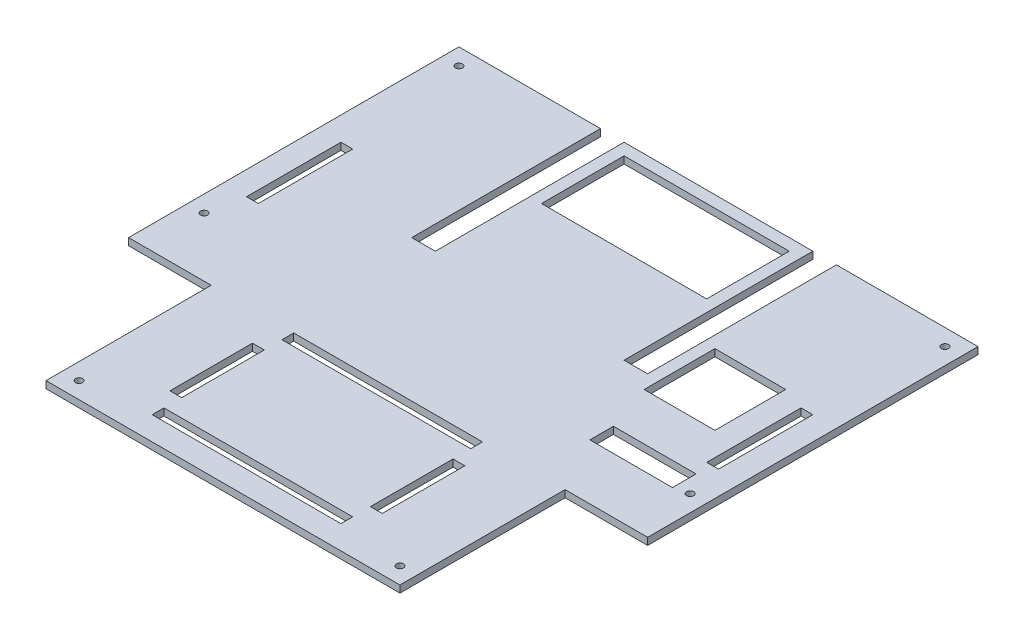
from build123d import *

# Parameters (mm, degrees)
SKETCH4_W           = 220
SKETCH4_H           = 210
BOSS_EXTRUDE1_DEPTH = 3
SKETCH5_W           = 35
SKETCH5_H           = 70
CUT_EXTRUDE1_DEPTH  = 3
SKETCH6_W           = 35
SKETCH6_H           = 70
CUT_EXTRUDE2_DEPTH  = 3
SKETCH22_R          = 1.5
CUT_EXTRUDE15_DEPTH = 3
SKETCH26_R          = 1.5
CUT_EXTRUDE16_DEPTH = 3
SKETCH24_R          = 1.5
CUT_EXTRUDE17_DEPTH = 3
SKETCH25_R          = 1.5
CUT_EXTRUDE18_DEPTH = 3
SKETCH27_R          = 1.5
CUT_EXTRUDE19_DEPTH = 3
SKETCH28_R          = 1.5
CUT_EXTRUDE20_DEPTH = 3
SKETCH56_W          = 10
SKETCH56_H          = 80
SKETCH56_W_2        = 70
SKETCH56_H_2        = 35
CUT_EXTRUDE21_DEPTH = 3
SKETCH57_W          = 80
SKETCH57_H          = 5
SKETCH57_W_2        = 5
SKETCH57_H_2        = 35
SKETCH57_H_3        = 40
SKETCH57_W_3        = 35
SKETCH57_H_4        = 10
SKETCH57_W_4        = 30
SKETCH57_H_5        = 30
CUT_EXTRUDE22_DEPTH = 3


with BuildPart() as part:
    # Sketch4 → Boss-Extrude1 (new body)
    with BuildSketch(Plane(origin=(0, 0, 0), x_dir=(1, 0, 0), z_dir=(0, 1, 0))):
        with Locations((-110, 105)):
            Rectangle(SKETCH4_W, SKETCH4_H)
    extrude(amount=BOSS_EXTRUDE1_DEPTH)

    # Sketch5 → Cut-Extrude1 (cut)
    with BuildSketch(Plane(origin=(0, 3, 0), x_dir=(1, 0, 0), z_dir=(0, 1, 0))):
        with Locations((-202.5, 35)):
            Rectangle(SKETCH5_W, SKETCH5_H)
    extrude(amount=-CUT_EXTRUDE1_DEPTH, mode=Mode.SUBTRACT)

    # Sketch6 → Cut-Extrude2 (cut)
    with BuildSketch(Plane(origin=(0, 3, 0), x_dir=(1, 0, 0), z_dir=(0, 1, 0))):
        with Locations((-17.5, 35)):
            Rectangle(SKETCH6_W, SKETCH6_H)
    extrude(amount=-CUT_EXTRUDE2_DEPTH, mode=Mode.SUBTRACT)

    # Sketch22 → Cut-Extrude15 (cut)
    with BuildSketch(Plane(origin=(0, 3, 0), x_dir=(1, 0, 0), z_dir=(0, 1, 0))):
        with Locations((-178, 7)):
            Circle(SKETCH22_R)
    extrude(amount=-CUT_EXTRUDE15_DEPTH, mode=Mode.SUBTRACT)

    # Sketch26 → Cut-Extrude16 (cut)
    with BuildSketch(Plane(origin=(0, 3, 0), x_dir=(1, 0, 0), z_dir=(0, 1, 0))):
        with Locations((-213, 203)):
            Circle(SKETCH26_R)
    extrude(amount=-CUT_EXTRUDE16_DEPTH, mode=Mode.SUBTRACT)

    # Sketch24 → Cut-Extrude17 (cut)
    with BuildSketch(Plane(origin=(0, 3, 0), x_dir=(1, 0, 0), z_dir=(0, 1, 0))):
        with Locations((-42, 7)):
            Circle(SKETCH24_R)
    extrude(amount=-CUT_EXTRUDE17_DEPTH, mode=Mode.SUBTRACT)

    # Sketch25 → Cut-Extrude18 (cut)
    with BuildSketch(Plane(origin=(0, 3, 0), x_dir=(1, 0, 0), z_dir=(0, 1, 0))):
        with Locations((-7, 203)):
            Circle(SKETCH25_R)
    extrude(amount=-CUT_EXTRUDE18_DEPTH, mode=Mode.SUBTRACT)

    # Sketch27 → Cut-Extrude19 (cut)
    with BuildSketch(Plane(origin=(0, 3, 0), x_dir=(1, 0, 0), z_dir=(0, 1, 0))):
        with Locations((-213, 95)):
            Circle(SKETCH27_R)
    extrude(amount=-CUT_EXTRUDE19_DEPTH, mode=Mode.SUBTRACT)

    # Sketch28 → Cut-Extrude20 (cut)
    with BuildSketch(Plane(origin=(0, 3, 0), x_dir=(1, 0, 0), z_dir=(0, 1, 0))):
        with Locations((-7, 95)):
            Circle(SKETCH28_R)
    extrude(amount=-CUT_EXTRUDE20_DEPTH, mode=Mode.SUBTRACT)

    # Sketch56 → Cut-Extrude21 (cut)
    with BuildSketch(Plane(origin=(0, 3, 0), x_dir=(1, 0, 0), z_dir=(0, 1, 0))):
        with Locations((-65, 170)):
            Rectangle(SKETCH56_W, SKETCH56_H)
        with Locations((-110, 187.5)):
            Rectangle(SKETCH56_W_2, SKETCH56_H_2)
        with Locations((-155, 170)):
            Rectangle(SKETCH56_W, SKETCH56_H)
    extrude(amount=-CUT_EXTRUDE21_DEPTH, mode=Mode.SUBTRACT)

    # Sketch57 → Cut-Extrude22 (cut)
    with BuildSketch(Plane(origin=(0, 3, 0), x_dir=(1, 0, 0), z_dir=(0, 1, 0))):
        with Locations((-110, 67.5)):
            Rectangle(SKETCH57_W, SKETCH57_H)
        with Locations((-110, 12.5)):
            Rectangle(SKETCH57_W, SKETCH57_H)
        with Locations((-67.5, 40)):
            Rectangle(SKETCH57_W_2, SKETCH57_H_2)
        with Locations((-152.5, 40)):
            Rectangle(SKETCH57_W_2, SKETCH57_H_2)
        with Locations((-12.5, 130)):
            Rectangle(SKETCH57_W_2, SKETCH57_H_3)
        with Locations((-207.5, 130)):
            Rectangle(SKETCH57_W_2, SKETCH57_H_3)
        with Locations((-30.5, 98.5)):
            Rectangle(SKETCH57_W_3, SKETCH57_H_4)
        with Locations((-40, 138.5)):
            Rectangle(SKETCH57_W_4, SKETCH57_H_5)
    extrude(amount=-CUT_EXTRUDE22_DEPTH, mode=Mode.SUBTRACT)


solid = part.part
